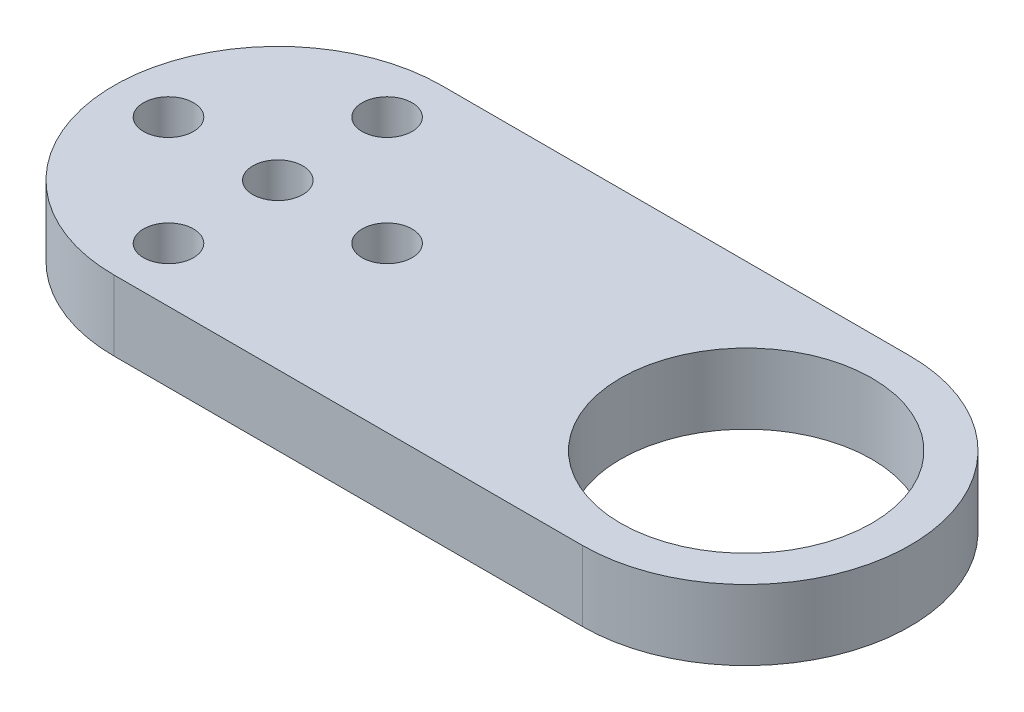
from build123d import *

# Parameters (mm, degrees)
BOSS_EXTRUDE1_DEPTH     = 4.5
SKETCH4_R               = 1.6
SERVO_HORN_HOLES_DEPTH  = 28.941904015
SKETCH5_R               = 8.05
BEARING_PRESS_FIT_DEPTH = 28.941904015


with BuildPart() as part:
    # Sketch2 → Boss-Extrude1 (new body)
    with BuildSketch(Plane(origin=(0, 0, 0), x_dir=(1, 0, 0), z_dir=(0, 1, 0))):
        with BuildLine():
            Line((15, 10.5), (-15, 10.5))
            ThreePointArc((-15, 10.5), (-25.5, 0), (-15, -10.5))
            Line((-15, -10.5), (15, -10.5))
            ThreePointArc((15, -10.5), (25.5, 0), (15, 10.5))
        make_face()
    extrude(amount=BOSS_EXTRUDE1_DEPTH)

    # Sketch4 → Servo horn holes (cut, through all)
    with BuildSketch(Plane(origin=(0, 4.5, 0), x_dir=(1, 0, 0), z_dir=(0, 1, 0))):
        with Locations((-15, 0)):
            Circle(SKETCH4_R)
        with Locations((-8, 0)):
            Circle(SKETCH4_R)
        with Locations((-15, -7)):
            Circle(SKETCH4_R)
        with Locations((-22, 0)):
            Circle(SKETCH4_R)
        with Locations((-15, 7)):
            Circle(SKETCH4_R)
    extrude(amount=-SERVO_HORN_HOLES_DEPTH, mode=Mode.SUBTRACT)

    # Sketch5 → Bearing press fit (cut, through all)
    with BuildSketch(Plane(origin=(0, 0, 0), x_dir=(-1, 0, 0), z_dir=(0, -1, 0))):
        with Locations((-15, 0)):
            Circle(SKETCH5_R)
    extrude(amount=-BEARING_PRESS_FIT_DEPTH, mode=Mode.SUBTRACT)


solid = part.part
